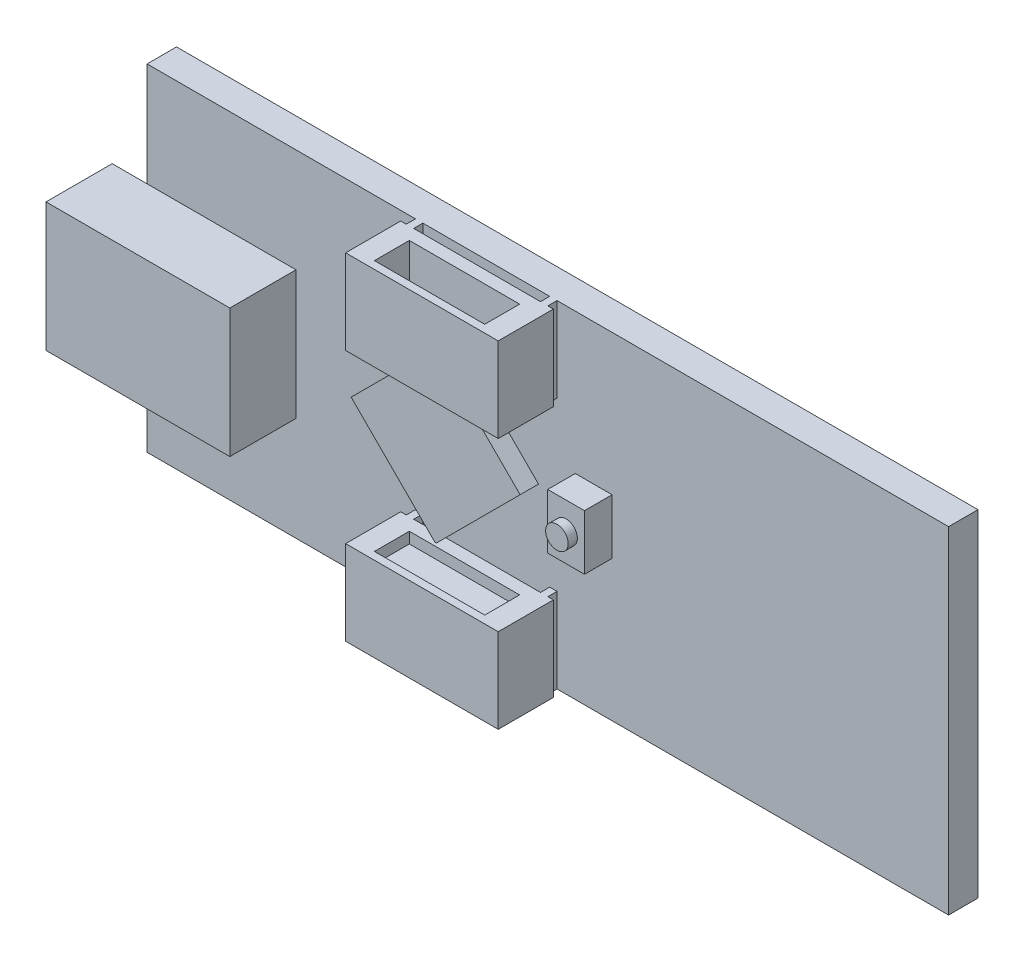
from build123d import *

# Parameters (mm, degrees)
SKETCH1_W            = 43.6
SKETCH1_H            = 18.3
BOSS_EXTRUDE1_DEPTH  = 1.6
USB_START            = 1.9
SKETCH2_W            = 3.6
SKETCH2_H            = 7
USB_CONNECTOR_DEPTH  = 10
MICROPROCESSOR_DEPTH = 1
SKETCH4_W            = 2
SKETCH4_H            = 3
BUTTON_BASE_DEPTH    = 1.5
SKETCH5_R            = 0.613578093
BUTTON_DEPTH         = 0.5
SKETCH6_W            = 8.3
SKETCH6_H            = 3
SKETCH6_W_2          = 6
SKETCH6_H_2          = 1.9
SKETCH6_W_3          = 0.4
SKETCH6_H_3          = 0.5
JST_X_6_DEPTH        = 4.6
BOSS_EXTRUDE8_START  = -4
SKETCH6_3_W          = 6
SKETCH6_3_H          = 1.9
BOSS_EXTRUDE8_DEPTH  = 0.8


with BuildPart() as part:
    # Sketch1 → Boss-Extrude1 (new body)
    with BuildSketch(Plane.XY):
        Rectangle(SKETCH1_W, SKETCH1_H)
    extrude(amount=BOSS_EXTRUDE1_DEPTH)

    # Sketch2 → USB Connector (add)
    with BuildSketch(Plane.ZY.offset(21.8).offset(USB_START)):
        with Locations((3.4, 0)):
            Rectangle(SKETCH2_W, SKETCH2_H)
    extrude(amount=-USB_CONNECTOR_DEPTH)

    # Sketch3 → MicroProcessor (add)
    with BuildSketch(Plane.XY.offset(1.6)):
        Polygon((-9.7, 0), (-5.103805922, 4.596194078), (-0.507611845, 0), (-5.103805922, -4.596194078), align=None)
    extrude(amount=MICROPROCESSOR_DEPTH)

    # Sketch4 → Button Base (add)
    with BuildSketch(Plane.XY.offset(1.6)):
        with Locations((2.492388155, 0)):
            Rectangle(SKETCH4_W, SKETCH4_H)
    extrude(amount=BUTTON_BASE_DEPTH)

    # Sketch5 → Button (add)
    with BuildSketch(Plane.XY.offset(3.1)):
        with Locations((2.492388155, 0)):
            Circle(SKETCH5_R)
    extrude(amount=BUTTON_DEPTH)


with BuildPart() as body_2:
    # Sketch6 → JST x 6 (new body)
    # profile 1 of 3: a face of its own
    with BuildSketch(Plane.XZ.offset(9.15)):
        with Locations((-3.35, 3.6)):
            Rectangle(SKETCH6_W, SKETCH6_H)
        with Locations((-3.35, 3.734337349)):
            Rectangle(SKETCH6_W_2, SKETCH6_H_2, mode=Mode.SUBTRACT)
    # profile 2 of 3: a face of its own
    with BuildSketch(Plane.XZ.offset(9.15)):
        with Locations((-7, 1.85)):
            Rectangle(SKETCH6_W_3, SKETCH6_H_3)
    # profile 3 of 3: a face of its own
    with BuildSketch(Plane.XZ.offset(9.15)):
        with Locations((0.3, 1.85)):
            Rectangle(SKETCH6_W_3, SKETCH6_H_3)
    jst_x_6 = extrude(amount=-JST_X_6_DEPTH)

    # Sketch6<3> → Boss-Extrude8 (add)
    with BuildSketch(Plane.XZ.offset(9.15).offset(BOSS_EXTRUDE8_START)):
        with Locations((-3.35, 3.734337349)):
            Rectangle(SKETCH6_3_W, SKETCH6_3_H)
    boss_extrude8 = extrude(amount=BOSS_EXTRUDE8_DEPTH)


with BuildPart() as part_1:
    add(part.part)

    # Mirror5: JST x 6, Boss-Extrude8 across plane
    add(jst_x_6.mirror(Plane.ZX))
    add(boss_extrude8.mirror(Plane.ZX))


solid = Compound([body_2.part, part_1.part])
